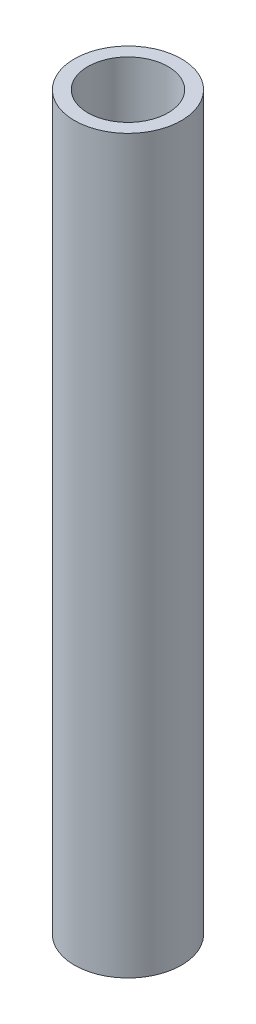
from build123d import *

# Parameters (mm, degrees)
SKETCH1_R           = 6.35
SKETCH1_R_2         = 4.7625
BOSS_EXTRUDE1_DEPTH = 86.825


with BuildPart() as part:
    # Sketch1 → Boss-Extrude1 (new body)
    with BuildSketch(Plane(origin=(0, 0, 0), x_dir=(1, 0, 0), z_dir=(0, 1, 0))):
        Circle(SKETCH1_R)
        Circle(SKETCH1_R_2, mode=Mode.SUBTRACT)
    extrude(amount=BOSS_EXTRUDE1_DEPTH)


solid = part.part
